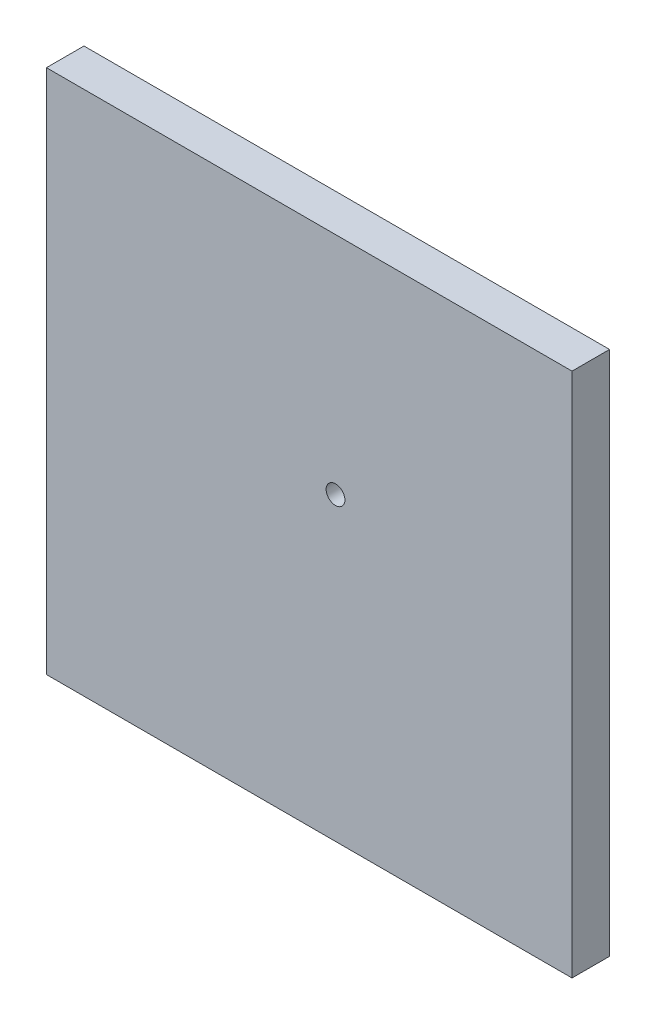
from build123d import *

# Parameters (mm, degrees)
SKETCH1_W           = 177.8
SKETCH1_H           = 177.8
BOSS_EXTRUDE1_DEPTH = 12.7
SKETCH2_R           = 3.175
CUT_EXTRUDE3_DEPTH  = 252.76769054


with BuildPart() as part:
    # Sketch1 → Boss-Extrude1 (new body)
    with BuildSketch(Plane.XY):
        with Locations((88.9, -88.9)):
            Rectangle(SKETCH1_W, SKETCH1_H)
    extrude(amount=BOSS_EXTRUDE1_DEPTH)

    # Sketch2 → Cut-Extrude3 (cut, through all)
    with BuildSketch(Plane.XY.offset(12.7)):
        with Locations((97.79, -76.2)):
            Circle(SKETCH2_R)
    extrude(amount=-CUT_EXTRUDE3_DEPTH, mode=Mode.SUBTRACT)


solid = part.part
